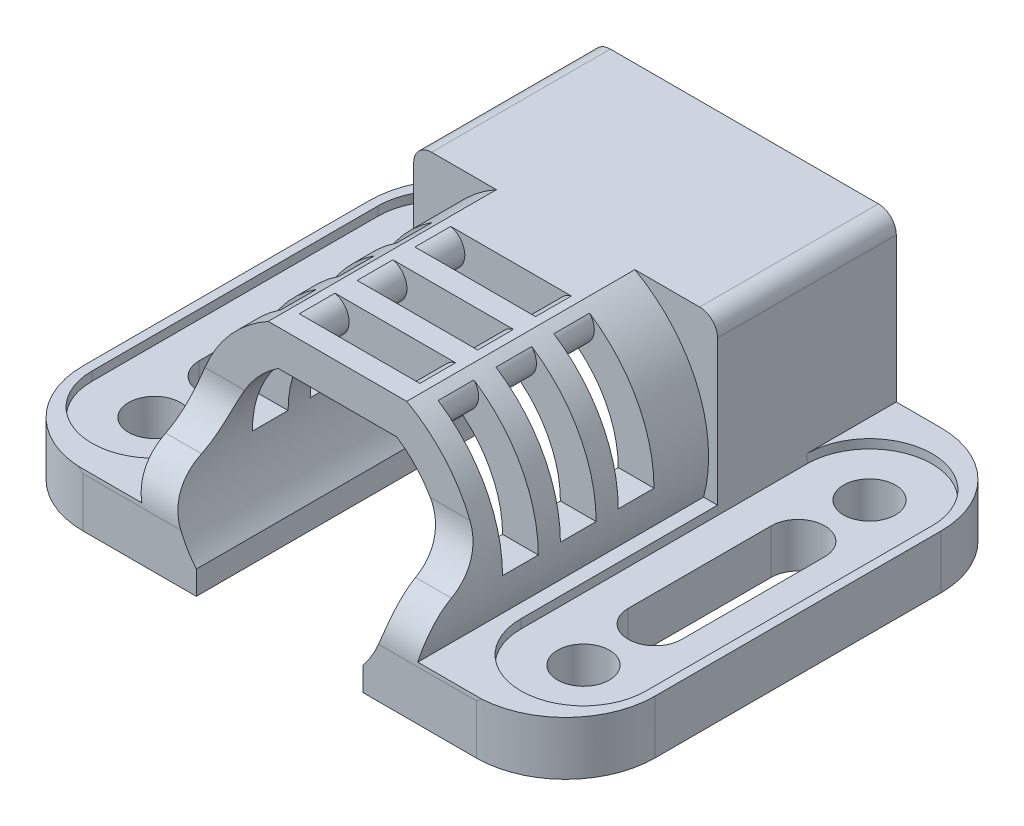
from build123d import *
from build123d.topology import SkipClean

# Parameters (mm, degrees)
SKETCH_1_R               = 1.45
EXTRUDE_1_DEPTH          = 3
EXTRUDE_1_2_DEPTH        = 3
EXTRUDE_3_DEPTH          = 16
OTHER_START              = -3
OTHER_2_DEPTH            = 16
OTHER_2_2_DEPTH          = 16
OTHER_2_3_DEPTH          = 16
OTHER_START_2            = -4
OTHER_2_4_OUTLINE_W      = 18
OTHER_2_4_OUTLINE_H      = 16
OTHER_2_4_DEPTH          = 7
OTHER_2_5_DEPTH          = 16
EXTRUDE_5_DEPTH          = 10
OTHER_START_3            = -13
OTHER_5_OUTLINE_W        = 2.5
OTHER_5_OUTLINE_H        = 3
OTHER_5_DEPTH            = 10
OTHER_5_2_OUTLINE_W      = 5.5
OTHER_5_2_OUTLINE_H      = 3
OTHER_5_2_DEPTH          = 10
OTHER_5_3_DEPTH          = 16
OTHER_START_4            = 6
OTHER_5_4_OUTLINE_W      = 3
OTHER_5_4_OUTLINE_H      = 10
OTHER_5_4_DEPTH          = 2.5
OTHER_5_5_OUTLINE_W      = 2.5
OTHER_5_5_OUTLINE_H      = 10
OTHER_5_5_DEPTH          = 3
OTHER_5_6_OUTLINE_W      = 5.5
OTHER_5_6_OUTLINE_H      = 3
OTHER_5_6_DEPTH          = 10
OTHER_5_7_DEPTH          = 16
FILLET_1_R               = 1
FILLET_2_R               = 1
SKETCH_6_W               = 9.324298968
SKETCH_6_H               = 3
CUT_EXTRUDE_1_DEPTH      = 26.659501164
SKETCH_7_W               = 4
SKETCH_7_H               = 2
EXTRUDE_6_DEPTH          = 2
SKETCH_8_W               = 17
SKETCH_8_H               = 2
CUT_EXTRUDE_2_DEPTH      = 7
EXTRUDE_7_DEPTH          = 11.708
CUT_EXTRUDE_6_DEPTH      = 0.5
CUT_EXTRUDE_7_DEPTH      = 24.904183734
CUT_EXTRUDE_7_DEPTH_BACK = 24.904183734
SKETCH_12_W              = 3.236
SKETCH_12_H              = 7
FILLET_3_R               = 3
FILLET_4_R               = 3


with BuildPart() as part:
    # Эскиз1 → Бобышка-Вытянуть1 (new body)
    with BuildSketch(Plane(origin=(0, 0, 0), x_dir=(1, 0, 0), z_dir=(0, 1, 0))):
        with BuildLine():
            Line((-11, 13), (-3, 13))
            Line((-3, 13), (-3, -13))
            Line((-3, -13), (-11, -13))
            ThreePointArc((-11, -13), (-14.535533906, -11.535533906), (-16, -8))
            Line((-16, -8), (-16, 8))
            ThreePointArc((-16, 8), (-14.535533906, 11.535533906), (-11, 13))
        make_face()
        with Locations(Location((-12, 8, 0), (0, 0, 270))):
            Circle(SKETCH_1_R, mode=Mode.SUBTRACT)
        with Locations(Location((-12, -8, 0), (0, 0, 270))):
            Circle(SKETCH_1_R, mode=Mode.SUBTRACT)
        with BuildLine():
            Line((-10.5, 4), (-10.5, -4))
            ThreePointArc((-10.5, -4), (-12, -5.5), (-13.5, -4))
            Line((-13.5, -4), (-13.5, 4))
            ThreePointArc((-13.5, 4), (-12, 5.5), (-10.5, 4))
        make_face(mode=Mode.SUBTRACT)
    extrude(amount=EXTRUDE_1_DEPTH)

    # Other 2 5 outline → Other 2 5 (cut)
    with BuildSketch(Plane.XY.offset(OTHER_START)):
        with BuildLine():
            ThreePointArc((-3.160696126, 0), (-4.63975683, 1.295705511), (-5.620498199, 3))
            Line((-5.620498199, 3), (-7.719455939, 3))
            ThreePointArc((-7.719455939, 3), (-7.101748396, 1.416907588), (-6.163602842, 0))
            Line((-6.163602842, 0), (-3.160696126, 0))
        make_face()
    extrude(amount=OTHER_2_5_DEPTH, mode=Mode.SUBTRACT)

    # Other 5 2 outline → Other 5 2 (cut)
    with BuildSketch(Plane.XY.offset(OTHER_START_3)):
        with Locations((-5.75, 1.5)):
            Rectangle(OTHER_5_2_OUTLINE_W, OTHER_5_2_OUTLINE_H)
    extrude(amount=OTHER_5_2_DEPTH, mode=Mode.SUBTRACT)

    # Other 5 3 outline → Other 5 3 (cut)
    with BuildSketch(Plane.XY.offset(OTHER_START)):
        with BuildLine():
            Line((-3, 3), (-5.620498199, 3))
            ThreePointArc((-5.620498199, 3), (-4.63975683, 1.295705511), (-3.160696126, 0))
            Line((-3.160696126, 0), (-3, 0))
            Line((-3, 0), (-3, 3))
        make_face()
    extrude(amount=OTHER_5_3_DEPTH, mode=Mode.SUBTRACT)


with BuildPart() as body_2:
    # Эскиз1 → Extrude 1 2 (new body)
    with BuildSketch(Plane(origin=(0, 0, 0), x_dir=(1, 0, 0), z_dir=(0, 1, 0))):
        with BuildLine():
            Line((3, 13), (11, 13))
            ThreePointArc((11, 13), (14.535533906, 11.535533906), (16, 8))
            Line((16, 8), (16, -8))
            ThreePointArc((16, -8), (14.535533906, -11.535533906), (11, -13))
            Line((11, -13), (3, -13))
            Line((3, -13), (3, 13))
        make_face()
        with Locations(Location((12, 8, 0), (0, 0, 270))):
            Circle(SKETCH_1_R, mode=Mode.SUBTRACT)
        with Locations(Location((12, -8, 0), (0, 0, 270))):
            Circle(SKETCH_1_R, mode=Mode.SUBTRACT)
        with BuildLine():
            Line((10.5, 4), (10.5, -4))
            ThreePointArc((10.5, -4), (12, -5.5), (13.5, -4))
            Line((13.5, -4), (13.5, 4))
            ThreePointArc((13.5, 4), (12, 5.5), (10.5, 4))
        make_face(mode=Mode.SUBTRACT)
    extrude(amount=EXTRUDE_1_2_DEPTH)

    # Other 2 3 outline → Other 2 3 (cut)
    with BuildSketch(Plane.XY.offset(OTHER_START)):
        with BuildLine():
            ThreePointArc((5.620498199, 3), (4.63975683, 1.295705511), (3.160696126, 0))
            Line((3.160696126, 0), (6.163602842, 0))
            ThreePointArc((6.163602842, 0), (7.101748396, 1.416907588), (7.719455939, 3))
            Line((7.719455939, 3), (5.620498199, 3))
        make_face()
    extrude(amount=OTHER_2_3_DEPTH, mode=Mode.SUBTRACT)

    # Other 5 6 outline → Other 5 6 (cut)
    with BuildSketch(Plane.XY.offset(OTHER_START_3)):
        with Locations((5.75, 1.5)):
            Rectangle(OTHER_5_6_OUTLINE_W, OTHER_5_6_OUTLINE_H)
    extrude(amount=OTHER_5_6_DEPTH, mode=Mode.SUBTRACT)

    # Other 5 7 outline → Other 5 7 (cut)
    with BuildSketch(Plane.XY.offset(OTHER_START)):
        with BuildLine():
            Line((3, 0), (3.160696126, 0))
            ThreePointArc((3.160696126, 0), (4.63975683, 1.295705511), (5.620498199, 3))
            Line((5.620498199, 3), (3, 3))
            Line((3, 3), (3, 0))
        make_face()
    extrude(amount=OTHER_5_7_DEPTH, mode=Mode.SUBTRACT)


with BuildPart() as body_3:
    # Эскиз4 → Бобышка-Вытянуть3 (new body)
    with BuildSketch(Plane.XY.offset(13)):
        with BuildLine():
            Line((3.872983346, 12.1), (-3.872983346, 12.1))
            ThreePointArc((-3.872983346, 12.1), (0, -2.9), (3.872983346, 12.1))
        make_face()
        with BuildLine():
            Line((-3.31662479, 10.1), (3.31662479, 10.1))
            ThreePointArc((3.31662479, 10.1), (0, -0.9), (-3.31662479, 10.1))
        make_face(mode=Mode.SUBTRACT)
    extrude(amount=-EXTRUDE_3_DEPTH)

    # Other 2 4 outline → Other 2 4 (cut)
    with BuildSketch(Plane(origin=(0, 0, 0), x_dir=(1, 0, 0), z_dir=(0, 1, 0)).offset(OTHER_START_2)):
        with Locations((0, -5)):
            Rectangle(OTHER_2_4_OUTLINE_W, OTHER_2_4_OUTLINE_H)
    extrude(amount=OTHER_2_4_DEPTH, mode=Mode.SUBTRACT)

    # Эскиз8 → Вырез-Вытянуть2 (cut)
    with BuildSketch(Plane(origin=(0, 12.1, 0), x_dir=(1, 0, 0), z_dir=(0, 1, 0))):
        with Locations((0, -1.056)):
            Rectangle(SKETCH_8_W, SKETCH_8_H)
        with Locations((0, -4.292)):
            Rectangle(SKETCH_8_W, SKETCH_8_H)
        with Locations((0, -7.528)):
            Rectangle(SKETCH_8_W, SKETCH_8_H)
        with Locations((0, -10.764)):
            Rectangle(SKETCH_8_W, SKETCH_8_H)
    extrude(amount=-CUT_EXTRUDE_2_DEPTH, mode=Mode.SUBTRACT)

    # Эскиз9 → Бобышка-Вытянуть7 (add)
    with SkipClean():  # the faces are left unmerged after this step: merging them gives an invalid solid
        with BuildSketch(Plane.XY.offset(0.056)):
            with BuildLine():
                Line((3.872983346, 12.1), (3.370964166, 12.1))
                ThreePointArc((3.370964166, 12.1), (3.315605963, 10.10031404), (4.397373599, 11.783046119))
                ThreePointArc((4.397373599, 11.783046119), (4.1382141, 11.946545411), (3.872983346, 12.1))
            make_face()
            with BuildLine():
                Line((-3.872983346, 12.1), (-3.370964166, 12.1))
                ThreePointArc((-3.370964166, 12.1), (-3.315605963, 10.10031404), (-4.397373599, 11.783046119))
                ThreePointArc((-4.397373599, 11.783046119), (-4.1382141, 11.946545411), (-3.872983346, 12.1))
            make_face()
        extrude(amount=EXTRUDE_7_DEPTH)


with BuildPart() as body_4:
    # Пересечение2: read off the stored shape, not the designer's step
    # Пересечение2 outline → Пересечение2 (new body)
    with BuildSketch(Plane.XY.offset(OTHER_START)):
        with BuildLine():
            ThreePointArc((-3.160696126, 0), (-4.63975683, 1.295705511), (-5.620498199, 3))
            Line((-5.620498199, 3), (-7.719455939, 3))
            ThreePointArc((-7.719455939, 3), (-7.101748396, 1.416907588), (-6.163602842, 0))
            Line((-6.163602842, 0), (-3.160696126, 0))
        make_face()
    extrude(amount=OTHER_2_DEPTH)


with BuildPart() as body_5:
    # Other 2 2 outline → Other 2 2 (new body)
    with BuildSketch(Plane.XY.offset(OTHER_START)):
        with BuildLine():
            ThreePointArc((6.163602842, 0), (7.101748396, 1.416907588), (7.719455939, 3))
            Line((7.719455939, 3), (5.620498199, 3))
            ThreePointArc((5.620498199, 3), (4.63975683, 1.295705511), (3.160696126, 0))
            Line((3.160696126, 0), (6.163602842, 0))
        make_face()
    extrude(amount=OTHER_2_2_DEPTH)


with BuildPart() as body_6:
    # Эскиз5 → Бобышка-Вытянуть5 (new body)
    with BuildSketch(Plane(origin=(0, 0, -13), x_dir=(-1, 0, 0), z_dir=(0, 0, -1))):
        with BuildLine():
            Line((-8.5, 0), (-6, 0))
            Line((-6, 0), (-6, 9.1))
            ThreePointArc((-6, 9.1), (-5.707106781, 9.807106781), (-5, 10.1))
            Line((-5, 10.1), (5, 10.1))
            ThreePointArc((5, 10.1), (5.707106781, 9.807106781), (6, 9.1))
            Line((6, 9.1), (6, 0))
            Line((6, 0), (8.5, 0))
            Line((8.5, 0), (8.5, 12.1))
            Line((8.5, 12.1), (-8.5, 12.1))
            Line((-8.5, 12.1), (-8.5, 0))
        make_face()
    extrude(amount=-EXTRUDE_5_DEPTH)

    # Other 5 5 outline → Other 5 5 (cut)
    with BuildSketch(Plane(origin=(0, 0, 0), x_dir=(1, 0, 0), z_dir=(0, 1, 0))):
        with Locations((7.25, 8)):
            Rectangle(OTHER_5_5_OUTLINE_W, OTHER_5_5_OUTLINE_H)
        with Locations((-7.25, 8)):
            Rectangle(OTHER_5_5_OUTLINE_W, OTHER_5_5_OUTLINE_H)
    extrude(amount=OTHER_5_5_DEPTH, mode=Mode.SUBTRACT)

    # Скругление1
    fillet_1_edges = [body_6.edges().sort_by_distance(p)[0] for p in [
        (8.5, 12.1, -8),
    ]]
    fillet(fillet_1_edges, radius=FILLET_1_R)

    # Скругление2
    fillet_2_edges = [body_6.edges().sort_by_distance(p)[0] for p in [
        (-8.5, 12.1, -8),
    ]]
    fillet(fillet_2_edges, radius=FILLET_2_R)

    # Эскиз7 → Бобышка-Вытянуть6 (add)
    with BuildSketch(Plane.XZ.offset(-10.1)):
        with Locations((4, -5)):
            Rectangle(SKETCH_7_W, SKETCH_7_H)
    extrude(amount=EXTRUDE_6_DEPTH)


with BuildPart() as body_7:
    # Пересечение5: read off the stored shape, not the designer's step
    # Пересечение5 outline → Пересечение5 (new body)
    with BuildSketch(Plane.XY.offset(OTHER_START_3)):
        with Locations((-7.25, 1.5)):
            Rectangle(OTHER_5_OUTLINE_W, OTHER_5_OUTLINE_H)
    extrude(amount=OTHER_5_DEPTH)


with BuildPart() as body_8:
    # Other 5 4 outline → Other 5 4 (new body)
    with BuildSketch(Plane.YZ.offset(OTHER_START_4)):
        with Locations((1.5, -8)):
            Rectangle(OTHER_5_4_OUTLINE_W, OTHER_5_4_OUTLINE_H)
    extrude(amount=OTHER_5_4_DEPTH)


with BuildPart() as cut_extrude_1_tool:
    # Эскиз6 → Вырез-Вытянуть1 (new, through all)
    with BuildSketch(Plane(origin=(0, 0, -3), x_dir=(-1, 0, 0), z_dir=(0, 0, -1))):
        with Locations((0, 1.5)):
            Rectangle(SKETCH_6_W, SKETCH_6_H)
    extrude(amount=-CUT_EXTRUDE_1_DEPTH)


with BuildPart() as body_4_1:
    add(body_4.part)

    # Вырез-Вытянуть1: cut by cut_extrude_1_tool
    add(cut_extrude_1_tool.part, mode=Mode.SUBTRACT)


with BuildPart() as body_5_1:
    add(body_5.part)

    # Вырез-Вытянуть1: cut by cut_extrude_1_tool
    add(cut_extrude_1_tool.part, mode=Mode.SUBTRACT)


with BuildPart() as body_2_1:
    add(body_2.part)

    # Combine 1: union body 6, body 5, body 8, body 3, body 4, part, body 7
    add(body_6.part)
    add(body_5_1.part)
    add(body_8.part)
    add(body_3.part)
    add(body_4_1.part)
    add(part.part)
    add(body_7.part)

    # Эскиз11 → Вырез-Вытянуть6 (cut)
    with SkipClean():  # the faces are left unmerged after this step: merging them gives an invalid solid
        with BuildSketch(Plane(origin=(0, 3, 0), x_dir=(1, 0, 0), z_dir=(0, 1, 0))):
            with BuildLine():
                Line((15.5, 8), (15.5, -8))
                ThreePointArc((15.5, -8), (12, -11.5), (8.5, -8))
                Line((8.5, -8), (8.5, 8))
                ThreePointArc((8.5, 8), (12, 11.5), (15.5, 8))
            make_face()
            with BuildLine():
                Line((-15.5, 8), (-15.5, -8))
                ThreePointArc((-15.5, -8), (-12, -11.5), (-8.5, -8))
                Line((-8.5, -8), (-8.5, 8))
                ThreePointArc((-8.5, 8), (-12, 11.5), (-15.5, 8))
            make_face()
        extrude(amount=-CUT_EXTRUDE_6_DEPTH, mode=Mode.SUBTRACT)

    # Эскиз12 → Вырез-Вытянуть7 (cut, two sides: drawn at the far end of the back side and taken through both)
    with SkipClean():  # the faces are left unmerged after this step: merging them gives an invalid solid
        with BuildSketch(Plane(origin=(0, 0, 0), x_dir=(0, 0, -1), z_dir=(1, 0, 0)).offset(-CUT_EXTRUDE_7_DEPTH_BACK)):
            with Locations((-11.382, 8.6)):
                Rectangle(SKETCH_12_W, SKETCH_12_H)
        extrude(amount=CUT_EXTRUDE_7_DEPTH + CUT_EXTRUDE_7_DEPTH_BACK, mode=Mode.SUBTRACT)

    # Скругление3
    fillet_3_edges = [body_2_1.edges().sort_by_distance(p)[0] for p in [
        (7, 5.1, 9.764),
        (-7, 5.1, 9.764),
    ]]
    fillet(fillet_3_edges, radius=FILLET_3_R)

    # Скругление4
    # the kernel refuses this fillet: 3 mm, written as the material it takes off along each edge
    with BuildSketch(Plane(origin=(-13.813598312, 5.1, 13), x_dir=(0, 0.20406849024989715, -0.9789566135877155), z_dir=(1, 0, 0)), Plane(origin=(0.186401688, 5.1, 13), x_dir=(0, 0.20406849024989818, -0.9789566135877152), z_dir=(1, 0, 0))) as fillet_4_piece_1:
        with BuildLine():
            CenterArc((2.462320949, -2.888709677), FILLET_4_R, 105.65515986, 62.569865346)
            Line((-0.474548892, -2.276504206), (-0.768235876, -2.215283659))
            Line((-0.768235876, -2.215283659), (-0.293686984, 0.061220547))
            Line((-0.293686984, 0.061220547), (0.061220547, 0.293686984))
            ThreePointArc((0.061220547, 0.293686984), (0.292254308, 0.24552682), (1.571826004, 0.288870968))
            Line((1.571826004, 0.288870968), (1.65278009, 0))
        make_face()
    extrude(amount=13.627196623, mode=Mode.SUBTRACT)


solid = body_2_1.part
